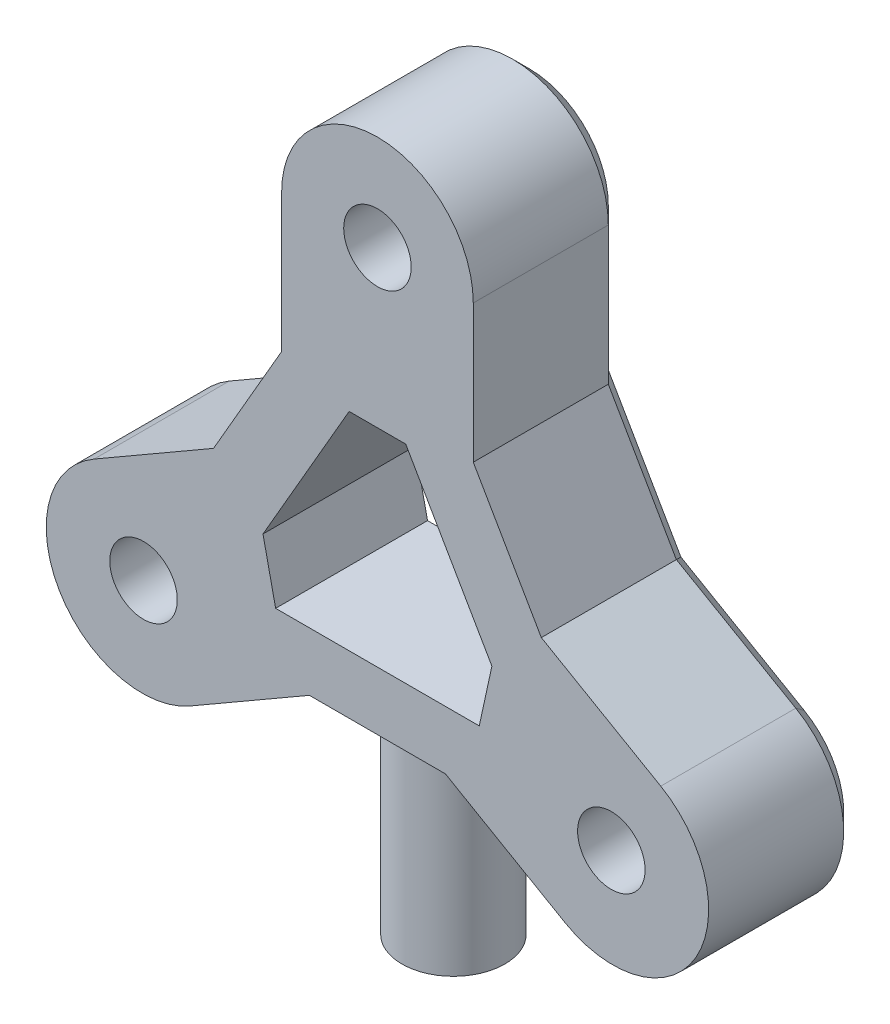
from build123d import *

# Parameters (mm, degrees)
SKETCH1_R                     = 34.694413408
BOSS_EXTRUDE1_DEPTH           = 14.2875
HOLE1_OUTLINE_R               = 6.35
HOLE1_DEPTH                   = 5.08
HOLE1_START                   = 5.08
HOLE1_2_OUTLINE_R             = 3.175
HOLE1_2_DEPTH                 = 9.2075
SKETCH9_R                     = 3.571875
CUT_EXTRUDE1_DEPTH            = 6.35
TAP_DRILL_FOR_6_32_TAP1_D     = 2.7051
TAP_DRILL_FOR_6_32_TAP1_DEPTH = 15.18930597
TAP_DRILL_FOR_6_32_TAP1_TIP   = 0.81269403
THREAD1_PITCH                 = 0.79375
SKETCH14_OUTSIDE_W            = 91.222
SKETCH14_OUTSIDE_H            = 91.222
CUT_EXTRUDE2_DEPTH            = 52.103202604
SKETCH15_W                    = 12.800507632
SKETCH15_H                    = 14.2875
SKETCH15_R                    = 4.841875
CUT_EXTRUDE3_DEPTH            = 19.836555
CHAMFER1_SIZE                 = 1.5875


# Read off the part's stored shape, not the designer's step: Hole1
with BuildPart() as part:
    # Sketch1 → Boss-Extrude1 (new body)
    with BuildSketch(Plane.XY):
        Circle(SKETCH1_R)
    extrude(amount=BOSS_EXTRUDE1_DEPTH)

    # Hole1 outline → Hole1 (cut)
    with BuildSketch(Plane.XY):
        with Locations((21.997045256, -12.7)):
            Circle(HOLE1_OUTLINE_R)
        with Locations((-21.997045256, -12.7)):
            Circle(HOLE1_OUTLINE_R)
        with Locations((0, 25.4)):
            Circle(HOLE1_OUTLINE_R)
    extrude(amount=HOLE1_DEPTH, mode=Mode.SUBTRACT)

    # Hole1 2 outline → Hole1 2 (cut)
    with BuildSketch(Plane.XY.offset(HOLE1_START)):
        with Locations((21.997045256, -12.7)):
            Circle(HOLE1_2_OUTLINE_R)
        with Locations((-21.997045256, -12.7)):
            Circle(HOLE1_2_OUTLINE_R)
        with Locations((0, 25.4)):
            Circle(HOLE1_2_OUTLINE_R)
    extrude(amount=HOLE1_2_DEPTH, mode=Mode.SUBTRACT)

    # Sketch9 → Cut-Extrude1 (cut)
    with BuildSketch(Plane(origin=(0, -34.694413408, 0), x_dir=(-1, 0, 0), z_dir=(0, -1, 0))):
        with Locations(Location((0, -7.14375, 0), (0, 0, 90))):
            Circle(SKETCH9_R)
    extrude(amount=-CUT_EXTRUDE1_DEPTH, mode=Mode.SUBTRACT)

    # Tap Drill for #6-32 Tap1
    with Locations(Plane(origin=(0, -28.344413408, 0), x_dir=(-1, 0, 0), z_dir=(0, -1, 0))):
        with Locations((0, -7.14375)):
            Hole(TAP_DRILL_FOR_6_32_TAP1_D / 2, depth=TAP_DRILL_FOR_6_32_TAP1_DEPTH)
            with Locations((0, 0, -(TAP_DRILL_FOR_6_32_TAP1_DEPTH + TAP_DRILL_FOR_6_32_TAP1_TIP / 2))):  # 118° drill point
                Cone(0, TAP_DRILL_FOR_6_32_TAP1_D / 2, TAP_DRILL_FOR_6_32_TAP1_TIP, mode=Mode.SUBTRACT)

    # Thread1: the profile of Thread Profile1 profile screwed along a right-hand helix of 19.136134 turns, 8 arcs to a turn; built about Z, then put on its axis
    thread1_z = Axis((0, 0, 0), (0, 0, 1))
    thread1_corners = [(1.35225, 0, -0.000173205), (1.782179788, 0, 0.248046874), (1.782179788, 0, 0.347265624), (1.35225, 0, 0.595485703)]
    with BuildLine(mode=Mode.PRIVATE) as thread1_profile:
        Line(thread1_corners[0], thread1_corners[1])
        Line(thread1_corners[1], thread1_corners[2])
        Line(thread1_corners[2], thread1_corners[3])
        Line(thread1_corners[3], thread1_corners[0])
    thread1_cap = Face(thread1_profile.wire())
    thread1_turn_angles = [0, 22.5, 45, 67.5, 90, 112.5, 135, 157.5, 180, 202.5, 225, 247.5, 270, 292.5, 315, 337.5, 360]
    thread1_turn_weights = [1, 0.9238795325112867, 1, 0.9238795325112867, 1, 0.9238795325112867, 1, 0.9238795325112867, 1, 0.9238795325112867, 1, 0.9238795325112867, 1, 0.9238795325112867, 1, 0.9238795325112867, 1]
    thread1_turn_rails = [Edge.make_bspline([Vector(p[0], p[1], 0).rotate(thread1_z, thread1_turn_angles[k]) / thread1_turn_weights[k] + Vector(0, 0, p[2] + THREAD1_PITCH * thread1_turn_angles[k] / 360) for k in range(17)], [0, 0, 0, 1, 1, 2, 2, 3, 3, 4, 4, 5, 5, 6, 6, 7, 7, 8, 8, 8], 2, thread1_turn_weights) for p in thread1_corners]
    thread1_turn_sides = [Face.make_surface_from_curves(thread1_turn_rails[p[0]], thread1_turn_rails[p[1]]) for p in [(0, 1), (1, 2), (2, 3), (3, 0)]]
    thread1_last_angles = [6840, 6862.5, 6885, 6887.004030932, 6889.008061864]
    thread1_last_weights = [1, 0.9238795325112867, 1, 0.9993883692603874, 1]
    thread1_last_rails = [Edge.make_bspline([Vector(p[0], p[1], 0).rotate(thread1_z, thread1_last_angles[k]) / thread1_last_weights[k] + Vector(0, 0, p[2] + THREAD1_PITCH * thread1_last_angles[k] / 360) for k in range(5)], [0, 0, 0, 1, 1, 2, 2, 2], 2, thread1_last_weights) for p in thread1_corners]
    thread1_last_sides = [Face.make_surface_from_curves(thread1_last_rails[p[0]], thread1_last_rails[p[1]]) for p in [(0, 1), (1, 2), (2, 3), (3, 0)]]
    thread1 = Plane(origin=(0, -13.155107438, 7.14375), x_dir=(-1, 0, 0), z_dir=(0, -1, 0)) * Solid(Shell([*[p.moved(Location((0, 0, THREAD1_PITCH * i))) for i in range(19) for p in thread1_turn_sides], *thread1_last_sides, thread1_cap, thread1_cap.rotate(thread1_z, 6889.008061864).moved(Location((0, 0, THREAD1_PITCH * 6889.008061864 / 360)))]))
    add(thread1, mode=Mode.SUBTRACT)

    # Sketch14 outside → Cut-Extrude2 (cut, through all)
    # profile 1 of 2: a face of its own
    with BuildSketch(Plane(origin=(0, 0, 0), x_dir=(-1, 0, 0), z_dir=(0, 0, -1))):
        Rectangle(SKETCH14_OUTSIDE_W, SKETCH14_OUTSIDE_H)
        with BuildLine():
            Line((9.012141218, 25.4), (9.012141218, 12.43264584))
            Line((9.012141218, 12.43264584), (15.412395034, 1.347081049))
            Line((15.412395034, 1.347081049), (26.642453156, -5.136596031))
            ThreePointArc((26.642453156, -5.136596031), (29.941125784, -17.447409876), (17.630311938, -20.746082504))
            Line((17.630311938, -20.746082504), (6.400253816, -14.262405425))
            Line((6.400253816, -14.262405425), (6.400253816, -34.098959996))
            Line((6.400253816, -34.098959996), (-6.400253816, -34.098959996))
            Line((-6.400253816, -34.098959996), (-6.400253816, -14.262405425))
            Line((-6.400253816, -14.262405425), (-17.630311938, -20.746082504))
            ThreePointArc((-17.630311938, -20.746082504), (-29.941125784, -17.447409876), (-26.642453156, -5.136596031))
            Line((-26.642453156, -5.136596031), (-15.412395034, 1.347081049))
            Line((-15.412395034, 1.347081049), (-9.012141218, 12.43264584))
            Line((-9.012141218, 12.43264584), (-9.012141218, 25.4))
            ThreePointArc((-9.012141218, 25.4), (0, 34.412141218), (9.012141218, 25.4))
        make_face(mode=Mode.SUBTRACT)
    # profile 2 of 2: a face of its own
    with BuildSketch(Plane(origin=(0, 0, 0), x_dir=(-1, 0, 0), z_dir=(0, 0, -1))):
        Polygon((-9.575253816, -8.763144111), (9.575253816, -8.763144111), (10.763872406, -3.301441579), (2.662141218, 10.731168468), (-2.662141218, 10.731168468), (-10.763872406, -3.301441579), align=None)
    extrude(amount=-CUT_EXTRUDE2_DEPTH, mode=Mode.SUBTRACT)

    # Sketch15 → Cut-Extrude3 (cut)
    with BuildSketch(Plane.XZ.offset(34.098959996)):
        with Locations((0, 7.14375)):
            Rectangle(SKETCH15_W, SKETCH15_H)
        with Locations(Location((0, 7.14375, 0), (0, 0, 270))):
            Circle(SKETCH15_R, mode=Mode.SUBTRACT)
    extrude(amount=-CUT_EXTRUDE3_DEPTH, mode=Mode.SUBTRACT)

    # Chamfer1
    chamfer1_edges = [part.edges().sort_by_distance(p)[0] for p in [
        (9.012141218, 18.91632292, 0),
        (0, -14.262404996, 0),
        (0, 34.412141218, 0),
        (-9.012141218, 18.91632292, 0),
        (-12.212268126, 6.889863445, 0),
        (-21.027424095, -1.894757491, 0),
        (-29.941125784, -17.447409876, 0),
        (-12.015282877, -17.504243965, 0),
        (12.015282877, -17.504243965, 0),
        (29.941125784, -17.447409876, 0),
        (21.027424095, -1.894757491, 0),
        (12.212268126, 6.889863445, 0),
    ]]
    chamfer(chamfer1_edges, length=CHAMFER1_SIZE)


solid = part.part
